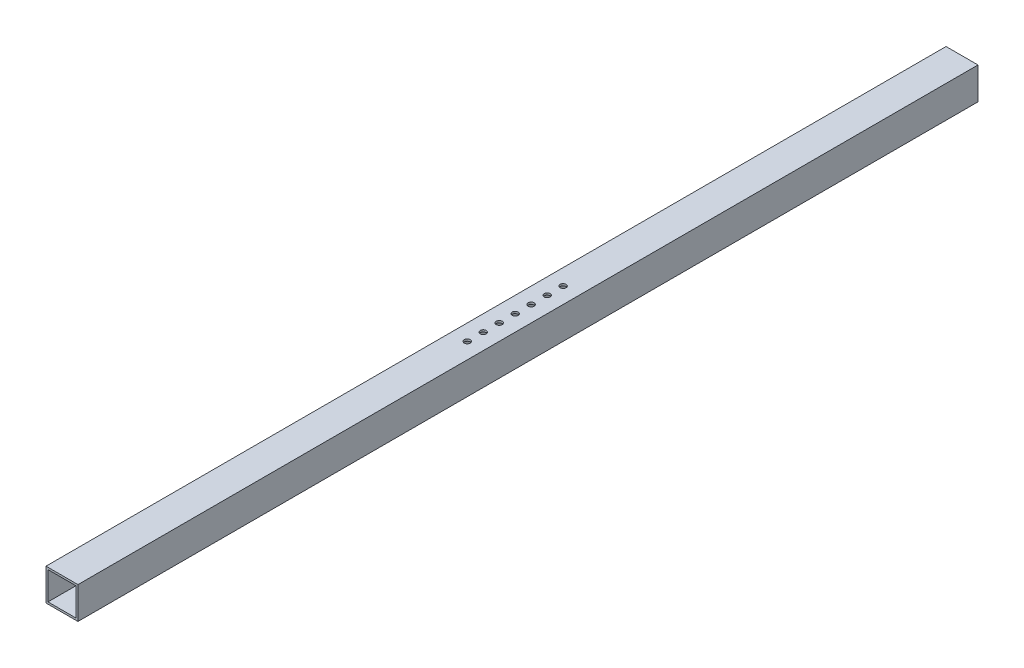
from build123d import *

# Parameters (mm, degrees)
SKETCH1_W           = 25.4
SKETCH1_H           = 25.4
SKETCH1_W_2         = 22.225
SKETCH1_H_2         = 22.225
BOSS_EXTRUDE1_DEPTH = 357.759
SKETCH2_R           = 2.38125
CUT_EXTRUDE1_DEPTH  = 359.884315736


with BuildPart() as part:
    # Sketch1 → Boss-Extrude1 (new, symmetric)
    with BuildSketch(Plane.XY):
        Rectangle(SKETCH1_W, SKETCH1_H)
        Rectangle(SKETCH1_W_2, SKETCH1_H_2, mode=Mode.SUBTRACT)
    extrude(amount=BOSS_EXTRUDE1_DEPTH, both=True)

    # Sketch2 → Cut-Extrude1 (cut, through all)
    with BuildSketch(Plane.XZ.offset(12.7)):
        with Locations((0, -40.633243854)):
            Circle(SKETCH2_R)
        with Locations((0, -27.933243854)):
            Circle(SKETCH2_R)
        with Locations((0, -15.233243854)):
            Circle(SKETCH2_R)
        with Locations((0, -2.533243854)):
            Circle(SKETCH2_R)
        with Locations((0, 10.166756146)):
            Circle(SKETCH2_R)
        with Locations((0, 22.866756146)):
            Circle(SKETCH2_R)
        with Locations((0, 35.566756146)):
            Circle(SKETCH2_R)
    extrude(amount=-CUT_EXTRUDE1_DEPTH, mode=Mode.SUBTRACT)


solid = part.part
